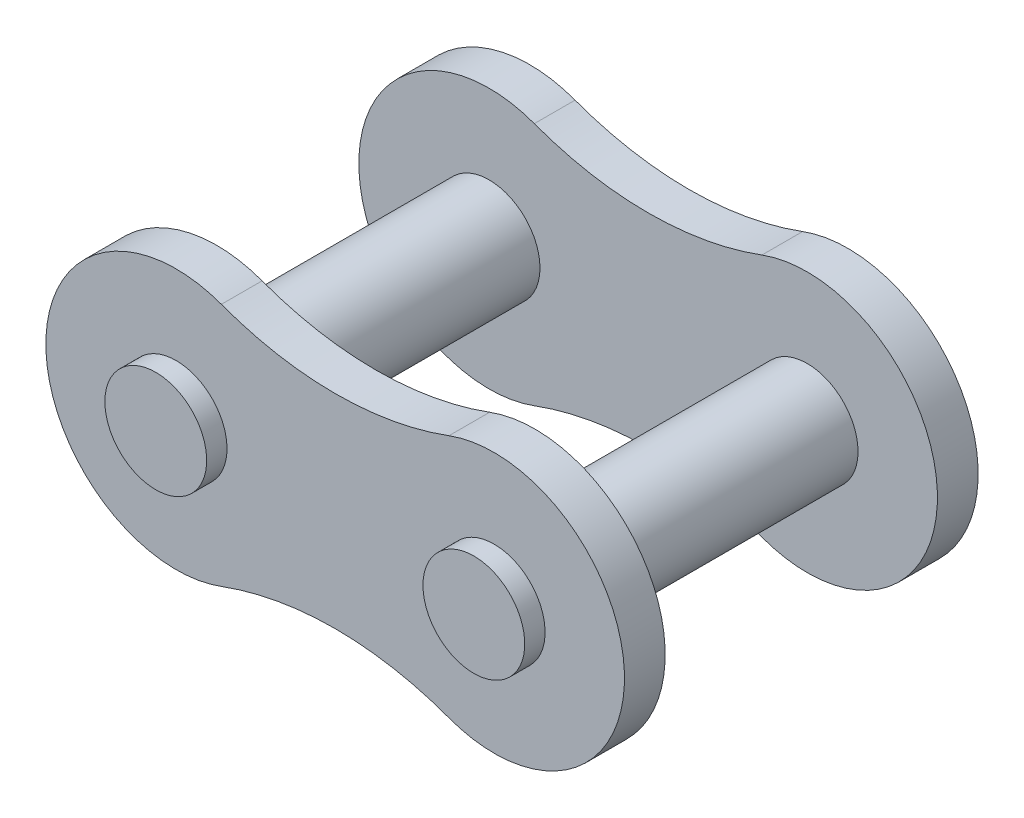
from build123d import *

# Parameters (mm, degrees)
BOSS_EXTRUDE1_DEPTH = 2.032
BOSS_EXTRUDE2_START = -3.048
SKETCH2_R           = 2.54
BOSS_EXTRUDE2_DEPTH = 16.637


# Read off the part's stored shape, not the designer's step: Boss-Extrude1
with BuildPart() as part:
    # Boss-Extrude1 outline → Boss-Extrude1 (new body)
    with BuildSketch(Plane.XY):
        with BuildLine():
            ThreePointArc((5.67954862, -6.097775113), (14.4399, 0), (5.67954862, 6.097775113))
            ThreePointArc((5.67954862, 6.097775113), (0, 5.08), (-5.67954862, 6.097775113))
            ThreePointArc((-5.67954862, 6.097775113), (-14.4399, 0), (-5.67954862, -6.097775113))
            ThreePointArc((-5.67954862, -6.097775113), (0, -5.08), (5.67954862, -6.097775113))
        make_face()
    boss_extrude1 = extrude(amount=BOSS_EXTRUDE1_DEPTH)

    # Sketch2 → Boss-Extrude2 (add)
    with BuildSketch(Plane.XY.offset(2.032).offset(BOSS_EXTRUDE2_START)):
        with Locations((-7.9375, 0)):
            Circle(SKETCH2_R)
        with Locations((7.9375, 0)):
            Circle(SKETCH2_R)
    boss_extrude2 = extrude(amount=BOSS_EXTRUDE2_DEPTH)

    # Mirror1: Boss-Extrude1, Boss-Extrude2 across plane
    add(boss_extrude1.mirror(Plane.XY.offset(8.8265)))
    add(boss_extrude2.mirror(Plane.XY.offset(8.8265)))


solid = part.part
